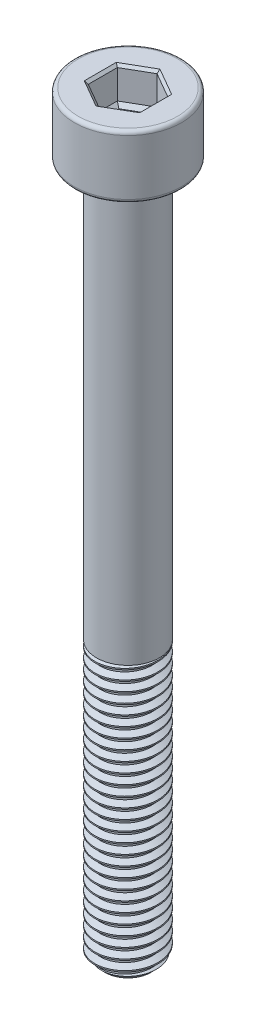
from build123d import *

# Parameters (mm, degrees)
SKETCH1_R           = 2.5
BOSS_EXTRUDE1_DEPTH = 22
THREAD1_PITCH       = 0.8
SKETCH2_R           = 2.5
BOSS_EXTRUDE2_DEPTH = 33
SKETCH3_R           = 4.25
BOSS_EXTRUDE3_DEPTH = 5
FILLET1_R           = 0.3
CUT_EXTRUDE1_DEPTH  = 2.5
CHAMFER1_SIZE       = 0.2
CUT_EXTRUDE2_DEPTH  = 0.3
CUT_EXTRUDE2_DRAFT  = -45


with BuildPart() as part:
    # Sketch1 → Boss-Extrude1 (new body)
    with BuildSketch(Plane(origin=(0, 0, 0), x_dir=(1, 0, 0), z_dir=(0, 1, 0))):
        with Locations(Location((0, 0, 0), (0, 0, 270))):
            Circle(SKETCH1_R)
    extrude(amount=BOSS_EXTRUDE1_DEPTH)

    # Thread1: the profile of Thread Profile1 profile screwed along a right-hand helix of 28.75 turns, 8 arcs to a turn; built about Z, then put on its axis
    thread1_z = Axis((0, 0, 0), (0, 0, 1))
    thread1_corners = [(2.5003, 0, -0.000173205), (2.5003, 0, 0.700173203), (2.0669873, 0, 0.449999999), (2.0669873, 0, 0.249999999)]
    with BuildLine(mode=Mode.PRIVATE) as thread1_profile:
        Line(thread1_corners[0], thread1_corners[1])
        Line(thread1_corners[1], thread1_corners[2])
        Line(thread1_corners[2], thread1_corners[3])
        Line(thread1_corners[3], thread1_corners[0])
    thread1_cap = Face(thread1_profile.wire())
    thread1_turn_angles = [0, 22.5, 45, 67.5, 90, 112.5, 135, 157.5, 180, 202.5, 225, 247.5, 270, 292.5, 315, 337.5, 360]
    thread1_turn_weights = [1, 0.9238795325112867, 1, 0.9238795325112867, 1, 0.9238795325112867, 1, 0.9238795325112867, 1, 0.9238795325112867, 1, 0.9238795325112867, 1, 0.9238795325112867, 1, 0.9238795325112867, 1]
    thread1_turn_rails = [Edge.make_bspline([Vector(p[0], p[1], 0).rotate(thread1_z, thread1_turn_angles[k]) / thread1_turn_weights[k] + Vector(0, 0, p[2] + THREAD1_PITCH * thread1_turn_angles[k] / 360) for k in range(17)], [0, 0, 0, 1, 1, 2, 2, 3, 3, 4, 4, 5, 5, 6, 6, 7, 7, 8, 8, 8], 2, thread1_turn_weights) for p in thread1_corners]
    thread1_turn_sides = [Face.make_surface_from_curves(thread1_turn_rails[p[0]], thread1_turn_rails[p[1]]) for p in [(0, 1), (1, 2), (2, 3), (3, 0)]]
    thread1_last_angles = [10080, 10102.5, 10125, 10147.5, 10170, 10192.5, 10215, 10237.5, 10260, 10282.5, 10305, 10327.5, 10350]
    thread1_last_weights = [1, 0.9238795325112867, 1, 0.9238795325112867, 1, 0.9238795325112867, 1, 0.9238795325112867, 1, 0.9238795325112867, 1, 0.9238795325112867, 1]
    thread1_last_rails = [Edge.make_bspline([Vector(p[0], p[1], 0).rotate(thread1_z, thread1_last_angles[k]) / thread1_last_weights[k] + Vector(0, 0, p[2] + THREAD1_PITCH * thread1_last_angles[k] / 360) for k in range(13)], [0, 0, 0, 1, 1, 2, 2, 3, 3, 4, 4, 5, 5, 6, 6, 6], 2, thread1_last_weights) for p in thread1_corners]
    thread1_last_sides = [Face.make_surface_from_curves(thread1_last_rails[p[0]], thread1_last_rails[p[1]]) for p in [(0, 1), (1, 2), (2, 3), (3, 0)]]
    thread1 = Plane(origin=(0, 23, 0), x_dir=(-1, 0, 0), z_dir=(0, -1, 0)) * Solid(Shell([*[p.moved(Location((0, 0, THREAD1_PITCH * i))) for i in range(28) for p in thread1_turn_sides], *thread1_last_sides, thread1_cap, thread1_cap.rotate(thread1_z, 10350).moved(Location((0, 0, THREAD1_PITCH * 10350 / 360)))]))
    add(thread1, mode=Mode.SUBTRACT)

    # Sketch2 → Boss-Extrude2 (add)
    with BuildSketch(Plane(origin=(0, 22, 0), x_dir=(1, 0, 0), z_dir=(0, 1, 0))):
        with Locations(Location((0, 0, 0), (0, 0, 90))):
            Circle(SKETCH2_R)
    extrude(amount=BOSS_EXTRUDE2_DEPTH)

    # Sketch3 → Boss-Extrude3 (add)
    with BuildSketch(Plane(origin=(0, 55, 0), x_dir=(1, 0, 0), z_dir=(0, 1, 0))):
        with Locations(Location((0, 0, 0), (0, 0, 270))):
            Circle(SKETCH3_R)
    extrude(amount=BOSS_EXTRUDE3_DEPTH)

    # Fillet1
    fillet1_edges = [part.edges().sort_by_distance(p)[0] for p in [
        (0, 55, -4.25),
        (0, 60, -4.25),
    ]]
    fillet(fillet1_edges, radius=FILLET1_R)

    # Sketch4 → Cut-Revolve1 (revolve, cut)
    with BuildSketch(Plane.XY, mode=Mode.PRIVATE) as cut_revolve1_sk:
        Polygon((2.51, 0), (2.51, 0.7), (1.81, 0), align=None)
    revolve(cut_revolve1_sk.sketch.rotate(Axis((0, 0, 0), (0, 1, 0)), 90), axis=Axis((0, 0, 0), (0, 1, 0)), mode=Mode.SUBTRACT)

    # Sketch5 → Cut-Extrude1 (cut)
    with BuildSketch(Plane(origin=(0, 60, 0), x_dir=(1, 0, 0), z_dir=(0, 1, 0))):
        Polygon((0, 2.309401077), (-2, 1.154700538), (-2, -1.154700538), (0, -2.309401077), (2, -1.154700538), (2, 1.154700538), align=None)
    extrude(amount=-CUT_EXTRUDE1_DEPTH, mode=Mode.SUBTRACT)

    # Chamfer1
    chamfer1_edges = [part.edges().sort_by_distance(p)[0] for p in [
        (1, 60, -1.732050808),
        (-1, 60, -1.732050808),
        (-2, 60, 0),
        (-1, 60, 1.732050808),
        (1, 60, 1.732050808),
        (2, 60, 0),
    ]]
    chamfer(chamfer1_edges, length=CHAMFER1_SIZE)


with BuildPart() as cut_extrude2_tool:
    # Sketch6 → Cut-Extrude2 (with draft: the straight prism first)
    with BuildSketch(Plane(origin=(0, 57.5, 0), x_dir=(1, 0, 0), z_dir=(0, 1, 0))):
        Polygon((0, 2.309401077), (-2, 1.154700538), (-2, -1.154700538), (0, -2.309401077), (2, -1.154700538), (2, 1.154700538), align=None)
    extrude(amount=-CUT_EXTRUDE2_DEPTH)
    # Cut-Extrude2: the draft: its side faces are tilted about the plane it starts from
    cut_extrude2_sides = [cut_extrude2_tool.faces().sort_by_distance(p)[0] for p in [
        (-1, 57.35, -1.732050808),
        (-2, 57.35, 0),
        (-1, 57.35, 1.732050808),
        (1, 57.35, 1.732050808),
        (2, 57.35, 0),
        (1, 57.35, -1.732050808),
    ]]
    draft(cut_extrude2_sides, Plane(origin=(0, 57.5, 0), x_dir=(1, 0, 0), z_dir=(0, 1, 0)), CUT_EXTRUDE2_DRAFT)


with BuildPart() as part_1:
    add(part.part)

    # Cut-Extrude2: cut by cut_extrude2_tool
    add(cut_extrude2_tool.part, mode=Mode.SUBTRACT)


solid = part_1.part
